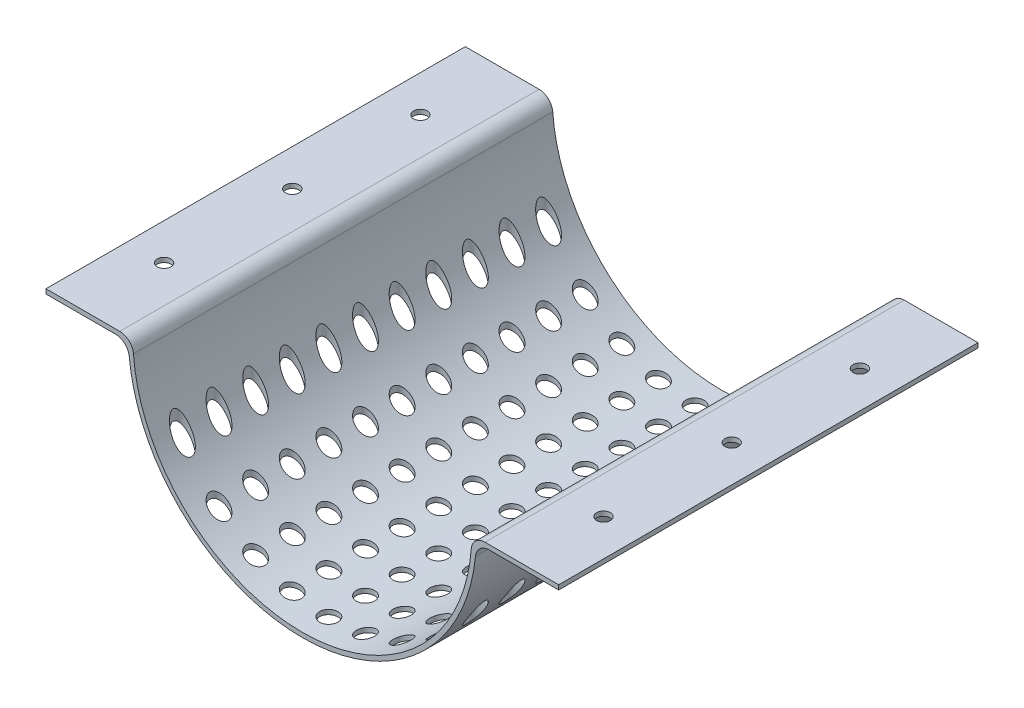
from build123d import *

# Parameters (mm, degrees)
BOSS_EXTRUDE1_DEPTH = 145.415
SKETCH2_R           = 6.35
CUT_EXTRUDE1_DEPTH  = 304.8
SKETCH3_R           = 4.7625
CUT_EXTRUDE2_DEPTH  = 76.2


with BuildPart() as part:
    # Sketch1 → Boss-Extrude1 (new, symmetric)
    with BuildSketch(Plane.XY):
        with BuildLine():
            Line((126.642308787, 0), (177.8, 0))
            Line((177.8, 0), (177.8, -3.175))
            Line((177.8, -3.175), (129.554006596, -3.175))
            ThreePointArc((129.554006596, -3.175), (123.155790262, -5.643906694), (120.074445137, -11.770731707))
            ThreePointArc((120.074445137, -11.770731707), (0, -120.65), (-120.074445137, -11.770731707))
            ThreePointArc((-120.074445137, -11.770731707), (-123.155790262, -5.643906694), (-129.554006596, -3.175))
            Line((-129.554006596, -3.175), (-177.8, -3.175))
            Line((-177.8, -3.175), (-177.8, 0))
            Line((-177.8, 0), (-126.642308787, 0))
            ThreePointArc((-126.642308787, 0), (-120.164608458, -2.54180421), (-117.144135628, -8.810625))
            ThreePointArc((-117.144135628, -8.810625), (0, -117.475), (117.144135628, -8.810625))
            ThreePointArc((117.144135628, -8.810625), (120.164608458, -2.54180421), (126.642308787, 0))
        make_face()
    extrude(amount=BOSS_EXTRUDE1_DEPTH, both=True)

    # Sketch2 → Cut-Extrude1 (cut)
    with BuildSketch(Plane(origin=(0, 0, 0), x_dir=(1, 0, 0), z_dir=(0, 1, 0))):
        with Locations(Location((0, 0, 0), (0, 0, 270))):
            Circle(SKETCH2_R)
        with Locations(Location((25.4, 0, 0), (0, 0, 270))):
            Circle(SKETCH2_R)
        with Locations(Location((50.8, 0, 0), (0, 0, 270))):
            Circle(SKETCH2_R)
        with Locations(Location((76.2, 0, 0), (0, 0, 270))):
            Circle(SKETCH2_R)
        with Locations(Location((101.6, 0, 0), (0, 0, 270))):
            Circle(SKETCH2_R)
        with Locations(Location((-50.8, 0, 0), (0, 0, 270))):
            Circle(SKETCH2_R)
        with Locations(Location((-101.6, 0, 0), (0, 0, 270))):
            Circle(SKETCH2_R)
        with Locations(Location((-76.2, 0, 0), (0, 0, 270))):
            Circle(SKETCH2_R)
        with Locations(Location((-25.4, 0, 0), (0, 0, 270))):
            Circle(SKETCH2_R)
        with Locations(Location((0, -25.4, 0), (0, 0, 270))):
            Circle(SKETCH2_R)
        with Locations(Location((25.4, -25.4, 0), (0, 0, 270))):
            Circle(SKETCH2_R)
        with Locations(Location((50.8, -25.4, 0), (0, 0, 270))):
            Circle(SKETCH2_R)
        with Locations(Location((76.2, -25.4, 0), (0, 0, 270))):
            Circle(SKETCH2_R)
        with Locations(Location((101.6, -25.4, 0), (0, 0, 270))):
            Circle(SKETCH2_R)
        with Locations(Location((-50.8, -25.4, 0), (0, 0, 270))):
            Circle(SKETCH2_R)
        with Locations(Location((-101.6, -25.4, 0), (0, 0, 270))):
            Circle(SKETCH2_R)
        with Locations(Location((-76.2, -25.4, 0), (0, 0, 270))):
            Circle(SKETCH2_R)
        with Locations(Location((-25.4, -25.4, 0), (0, 0, 270))):
            Circle(SKETCH2_R)
        with Locations(Location((0, -50.8, 0), (0, 0, 270))):
            Circle(SKETCH2_R)
        with Locations(Location((25.4, -50.8, 0), (0, 0, 270))):
            Circle(SKETCH2_R)
        with Locations(Location((50.8, -50.8, 0), (0, 0, 270))):
            Circle(SKETCH2_R)
        with Locations(Location((76.2, -50.8, 0), (0, 0, 270))):
            Circle(SKETCH2_R)
        with Locations(Location((101.6, -50.8, 0), (0, 0, 270))):
            Circle(SKETCH2_R)
        with Locations(Location((-50.8, -50.8, 0), (0, 0, 270))):
            Circle(SKETCH2_R)
        with Locations(Location((-101.6, -50.8, 0), (0, 0, 270))):
            Circle(SKETCH2_R)
        with Locations(Location((-76.2, -50.8, 0), (0, 0, 270))):
            Circle(SKETCH2_R)
        with Locations(Location((-25.4, -50.8, 0), (0, 0, 270))):
            Circle(SKETCH2_R)
        with Locations(Location((0, -76.2, 0), (0, 0, 270))):
            Circle(SKETCH2_R)
        with Locations(Location((25.4, -76.2, 0), (0, 0, 270))):
            Circle(SKETCH2_R)
        with Locations(Location((50.8, -76.2, 0), (0, 0, 270))):
            Circle(SKETCH2_R)
        with Locations(Location((76.2, -76.2, 0), (0, 0, 270))):
            Circle(SKETCH2_R)
        with Locations(Location((101.6, -76.2, 0), (0, 0, 270))):
            Circle(SKETCH2_R)
        with Locations(Location((-50.8, -76.2, 0), (0, 0, 270))):
            Circle(SKETCH2_R)
        with Locations(Location((-101.6, -76.2, 0), (0, 0, 270))):
            Circle(SKETCH2_R)
        with Locations(Location((-76.2, -76.2, 0), (0, 0, 270))):
            Circle(SKETCH2_R)
        with Locations(Location((-25.4, -76.2, 0), (0, 0, 270))):
            Circle(SKETCH2_R)
        with Locations(Location((0, -101.6, 0), (0, 0, 270))):
            Circle(SKETCH2_R)
        with Locations(Location((25.4, -101.6, 0), (0, 0, 270))):
            Circle(SKETCH2_R)
        with Locations(Location((50.8, -101.6, 0), (0, 0, 270))):
            Circle(SKETCH2_R)
        with Locations(Location((76.2, -101.6, 0), (0, 0, 270))):
            Circle(SKETCH2_R)
        with Locations(Location((101.6, -101.6, 0), (0, 0, 270))):
            Circle(SKETCH2_R)
        with Locations(Location((-50.8, -101.6, 0), (0, 0, 270))):
            Circle(SKETCH2_R)
        with Locations(Location((-101.6, -101.6, 0), (0, 0, 270))):
            Circle(SKETCH2_R)
        with Locations(Location((-76.2, -101.6, 0), (0, 0, 270))):
            Circle(SKETCH2_R)
        with Locations(Location((-25.4, -101.6, 0), (0, 0, 270))):
            Circle(SKETCH2_R)
        with Locations(Location((0, -127, 0), (0, 0, 270))):
            Circle(SKETCH2_R)
        with Locations(Location((25.4, -127, 0), (0, 0, 270))):
            Circle(SKETCH2_R)
        with Locations(Location((50.8, -127, 0), (0, 0, 270))):
            Circle(SKETCH2_R)
        with Locations(Location((76.2, -127, 0), (0, 0, 270))):
            Circle(SKETCH2_R)
        with Locations(Location((101.6, -127, 0), (0, 0, 270))):
            Circle(SKETCH2_R)
        with Locations(Location((-50.8, -127, 0), (0, 0, 270))):
            Circle(SKETCH2_R)
        with Locations(Location((-101.6, -127, 0), (0, 0, 270))):
            Circle(SKETCH2_R)
        with Locations(Location((-76.2, -127, 0), (0, 0, 270))):
            Circle(SKETCH2_R)
        with Locations(Location((-25.4, -127, 0), (0, 0, 270))):
            Circle(SKETCH2_R)
        with Locations(Location((-25.4, 127, 0), (0, 0, 270))):
            Circle(SKETCH2_R)
        with Locations(Location((-76.2, 127, 0), (0, 0, 270))):
            Circle(SKETCH2_R)
        with Locations(Location((-101.6, 127, 0), (0, 0, 270))):
            Circle(SKETCH2_R)
        with Locations(Location((-50.8, 127, 0), (0, 0, 270))):
            Circle(SKETCH2_R)
        with Locations(Location((101.6, 127, 0), (0, 0, 270))):
            Circle(SKETCH2_R)
        with Locations(Location((76.2, 127, 0), (0, 0, 270))):
            Circle(SKETCH2_R)
        with Locations(Location((50.8, 127, 0), (0, 0, 270))):
            Circle(SKETCH2_R)
        with Locations(Location((25.4, 127, 0), (0, 0, 270))):
            Circle(SKETCH2_R)
        with Locations(Location((0, 127, 0), (0, 0, 270))):
            Circle(SKETCH2_R)
        with Locations(Location((-25.4, 101.6, 0), (0, 0, 270))):
            Circle(SKETCH2_R)
        with Locations(Location((-76.2, 101.6, 0), (0, 0, 270))):
            Circle(SKETCH2_R)
        with Locations(Location((-101.6, 101.6, 0), (0, 0, 270))):
            Circle(SKETCH2_R)
        with Locations(Location((-50.8, 101.6, 0), (0, 0, 270))):
            Circle(SKETCH2_R)
        with Locations(Location((101.6, 101.6, 0), (0, 0, 270))):
            Circle(SKETCH2_R)
        with Locations(Location((76.2, 101.6, 0), (0, 0, 270))):
            Circle(SKETCH2_R)
        with Locations(Location((50.8, 101.6, 0), (0, 0, 270))):
            Circle(SKETCH2_R)
        with Locations(Location((25.4, 101.6, 0), (0, 0, 270))):
            Circle(SKETCH2_R)
        with Locations(Location((0, 101.6, 0), (0, 0, 270))):
            Circle(SKETCH2_R)
        with Locations(Location((-25.4, 76.2, 0), (0, 0, 270))):
            Circle(SKETCH2_R)
        with Locations(Location((-76.2, 76.2, 0), (0, 0, 270))):
            Circle(SKETCH2_R)
        with Locations(Location((-101.6, 76.2, 0), (0, 0, 270))):
            Circle(SKETCH2_R)
        with Locations(Location((-50.8, 76.2, 0), (0, 0, 270))):
            Circle(SKETCH2_R)
        with Locations(Location((101.6, 76.2, 0), (0, 0, 270))):
            Circle(SKETCH2_R)
        with Locations(Location((76.2, 76.2, 0), (0, 0, 270))):
            Circle(SKETCH2_R)
        with Locations(Location((50.8, 76.2, 0), (0, 0, 270))):
            Circle(SKETCH2_R)
        with Locations(Location((25.4, 76.2, 0), (0, 0, 270))):
            Circle(SKETCH2_R)
        with Locations(Location((0, 76.2, 0), (0, 0, 270))):
            Circle(SKETCH2_R)
        with Locations(Location((-25.4, 50.8, 0), (0, 0, 270))):
            Circle(SKETCH2_R)
        with Locations(Location((-76.2, 50.8, 0), (0, 0, 270))):
            Circle(SKETCH2_R)
        with Locations(Location((-101.6, 50.8, 0), (0, 0, 270))):
            Circle(SKETCH2_R)
        with Locations(Location((-50.8, 50.8, 0), (0, 0, 270))):
            Circle(SKETCH2_R)
        with Locations(Location((101.6, 50.8, 0), (0, 0, 270))):
            Circle(SKETCH2_R)
        with Locations(Location((76.2, 50.8, 0), (0, 0, 270))):
            Circle(SKETCH2_R)
        with Locations(Location((50.8, 50.8, 0), (0, 0, 270))):
            Circle(SKETCH2_R)
        with Locations(Location((25.4, 50.8, 0), (0, 0, 270))):
            Circle(SKETCH2_R)
        with Locations(Location((0, 50.8, 0), (0, 0, 270))):
            Circle(SKETCH2_R)
        with Locations(Location((-25.4, 25.4, 0), (0, 0, 270))):
            Circle(SKETCH2_R)
        with Locations(Location((-76.2, 25.4, 0), (0, 0, 270))):
            Circle(SKETCH2_R)
        with Locations(Location((-101.6, 25.4, 0), (0, 0, 270))):
            Circle(SKETCH2_R)
        with Locations(Location((-50.8, 25.4, 0), (0, 0, 270))):
            Circle(SKETCH2_R)
        with Locations(Location((101.6, 25.4, 0), (0, 0, 270))):
            Circle(SKETCH2_R)
        with Locations(Location((76.2, 25.4, 0), (0, 0, 270))):
            Circle(SKETCH2_R)
        with Locations(Location((50.8, 25.4, 0), (0, 0, 270))):
            Circle(SKETCH2_R)
        with Locations(Location((25.4, 25.4, 0), (0, 0, 270))):
            Circle(SKETCH2_R)
        with Locations(Location((0, 25.4, 0), (0, 0, 270))):
            Circle(SKETCH2_R)
    extrude(amount=-CUT_EXTRUDE1_DEPTH, mode=Mode.SUBTRACT)

    # Sketch3 → Cut-Extrude2 (cut)
    with BuildSketch(Plane(origin=(0, 0, 0), x_dir=(1, 0, 0), z_dir=(0, 1, 0))):
        with Locations(Location((152.4, 0, 0), (0, 0, 180))):
            Circle(SKETCH3_R)
        with Locations(Location((152.4, 88.9, 0), (0, 0, 180))):
            Circle(SKETCH3_R)
        with Locations(Location((152.4, -88.9, 0), (0, 0, 180))):
            Circle(SKETCH3_R)
        with Locations(Location((-152.4, -88.9, 0), (0, 0, 180))):
            Circle(SKETCH3_R)
        with Locations(Location((-152.4, 0, 0), (0, 0, 180))):
            Circle(SKETCH3_R)
        with Locations(Location((-152.4, 88.9, 0), (0, 0, 180))):
            Circle(SKETCH3_R)
    extrude(amount=-CUT_EXTRUDE2_DEPTH, mode=Mode.SUBTRACT)


solid = part.part
